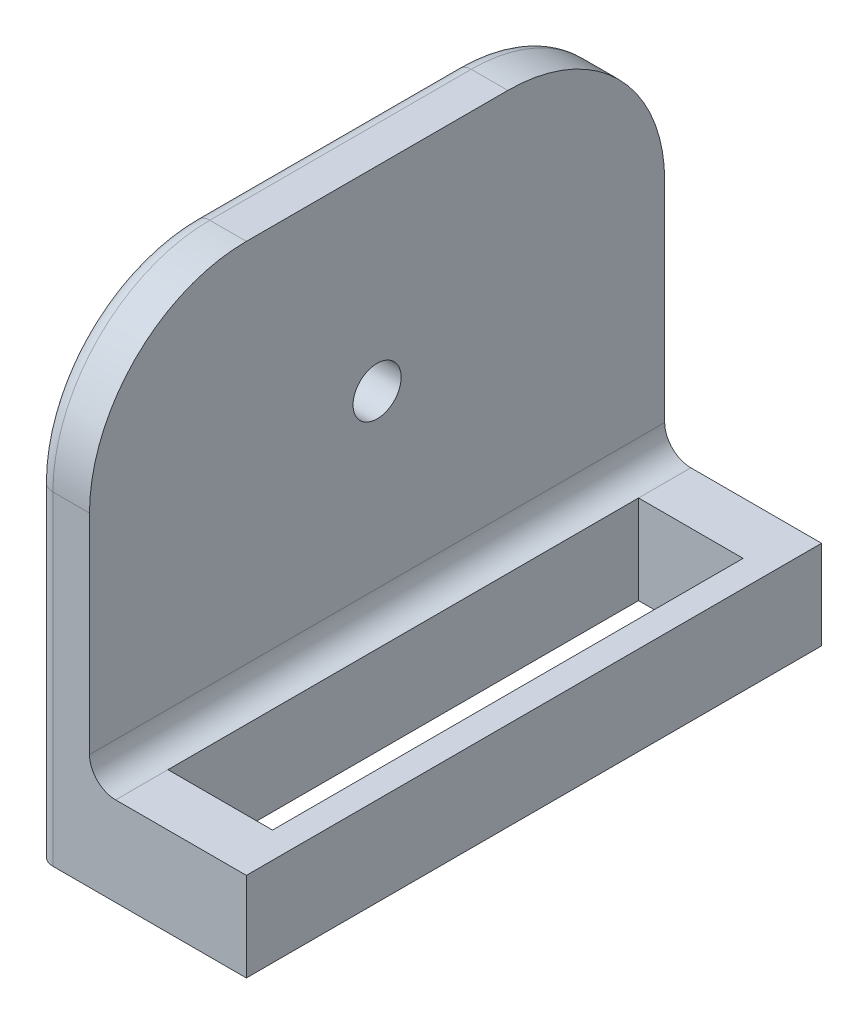
from build123d import *

# Parameters (mm, degrees)
SKETCH1_W           = 40
SKETCH1_H           = 110
BOSS_EXTRUDE1_DEPTH = 17
SKETCH4_W           = 110
SKETCH4_H           = 75
BOSS_EXTRUDE2_DEPTH = 10
SKETCH5_W           = 20
SKETCH5_H           = 90
CUT_EXTRUDE1_DEPTH  = 17
SKETCH6_R           = 4.6
CUT_EXTRUDE2_DEPTH  = 10
FILLET1_R           = 30
FILLET2_R           = 3
FILLET3_R           = 5


with BuildPart() as part:
    # Sketch1 → Boss-Extrude1 (new body)
    with BuildSketch(Plane(origin=(0, 0, 0), x_dir=(1, 0, 0), z_dir=(0, 1, 0))):
        with Locations((20, 55)):
            Rectangle(SKETCH1_W, SKETCH1_H)
    extrude(amount=BOSS_EXTRUDE1_DEPTH)

    # Sketch4 → Boss-Extrude2 (add)
    with BuildSketch(Plane(origin=(0, 0, 0), x_dir=(0, 0, -1), z_dir=(1, 0, 0))):
        with Locations((55, 54.5)):
            Rectangle(SKETCH4_W, SKETCH4_H)
    extrude(amount=BOSS_EXTRUDE2_DEPTH)

    # Sketch5 → Cut-Extrude1 (cut)
    with BuildSketch(Plane(origin=(0, 17, 0), x_dir=(1, 0, 0), z_dir=(0, 1, 0))):
        with Locations((25, 55)):
            Rectangle(SKETCH5_W, SKETCH5_H)
    extrude(amount=-CUT_EXTRUDE1_DEPTH, mode=Mode.SUBTRACT)

    # Sketch6 → Cut-Extrude2 (cut)
    with BuildSketch(Plane(origin=(10, 0, 0), x_dir=(0, 0, -1), z_dir=(1, 0, 0))):
        with Locations((55, 54.7)):
            Circle(SKETCH6_R)
    extrude(amount=-CUT_EXTRUDE2_DEPTH, mode=Mode.SUBTRACT)

    # Fillet1
    fillet1_edges = [part.edges().sort_by_distance(p)[0] for p in [
        (5, 92, 0),
        (5, 92, -110),
    ]]
    fillet(fillet1_edges, radius=FILLET1_R)

    # Fillet2
    fillet2_edges = [part.edges().sort_by_distance(p)[0] for p in [
        (0, 31, 0),
        (0, 92, -55),
        (0, 31, -110),
        (0, 83.213203436, -101.213203436),
        (0, 83.213203436, -8.786796564),
    ]]
    fillet(fillet2_edges, radius=FILLET2_R)

    # Fillet3
    fillet3_edges = [part.edges().sort_by_distance(p)[0] for p in [
        (10, 17, -55),
    ]]
    fillet(fillet3_edges, radius=FILLET3_R - 0.0001)  # a hair under: the kernel refuses the full size


solid = part.part
